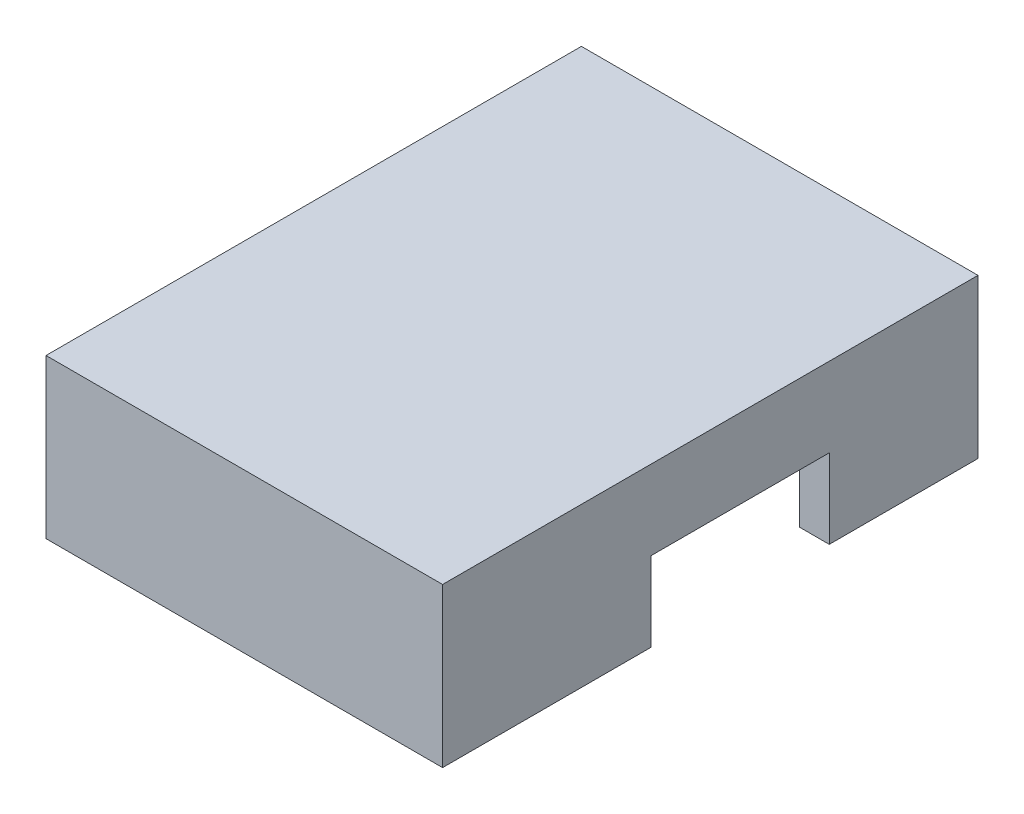
from build123d import *

# Parameters (mm, degrees)
SKETCH1_W           = 20
SKETCH1_H           = 27
BOSS_EXTRUDE1_DEPTH = 8
SKETCH2_W           = 9
SKETCH2_H           = 4
CUT_EXTRUDE1_DEPTH  = 20
SKETCH3_W           = 17
SKETCH3_H           = 24
CUT_EXTRUDE2_DEPTH  = 5


with BuildPart() as part:
    # Sketch1 → Boss-Extrude1 (new body)
    with BuildSketch(Plane(origin=(0, 0, 0), x_dir=(1, 0, 0), z_dir=(0, 1, 0))):
        with Locations((-10.903225806, -3.629032258)):
            Rectangle(SKETCH1_W, SKETCH1_H)
    extrude(amount=BOSS_EXTRUDE1_DEPTH)

    # Sketch2 → Cut-Extrude1 (cut)
    with BuildSketch(Plane.ZY.offset(20.903225806)):
        with Locations((2.129032258, 2)):
            Rectangle(SKETCH2_W, SKETCH2_H)
    extrude(amount=-CUT_EXTRUDE1_DEPTH, mode=Mode.SUBTRACT)

    # Sketch3 → Cut-Extrude2 (cut)
    with BuildSketch(Plane.XZ):
        with Locations((-10.903225806, 3.629032258)):
            Rectangle(SKETCH3_W, SKETCH3_H)
    extrude(amount=-CUT_EXTRUDE2_DEPTH, mode=Mode.SUBTRACT)


solid = part.part
